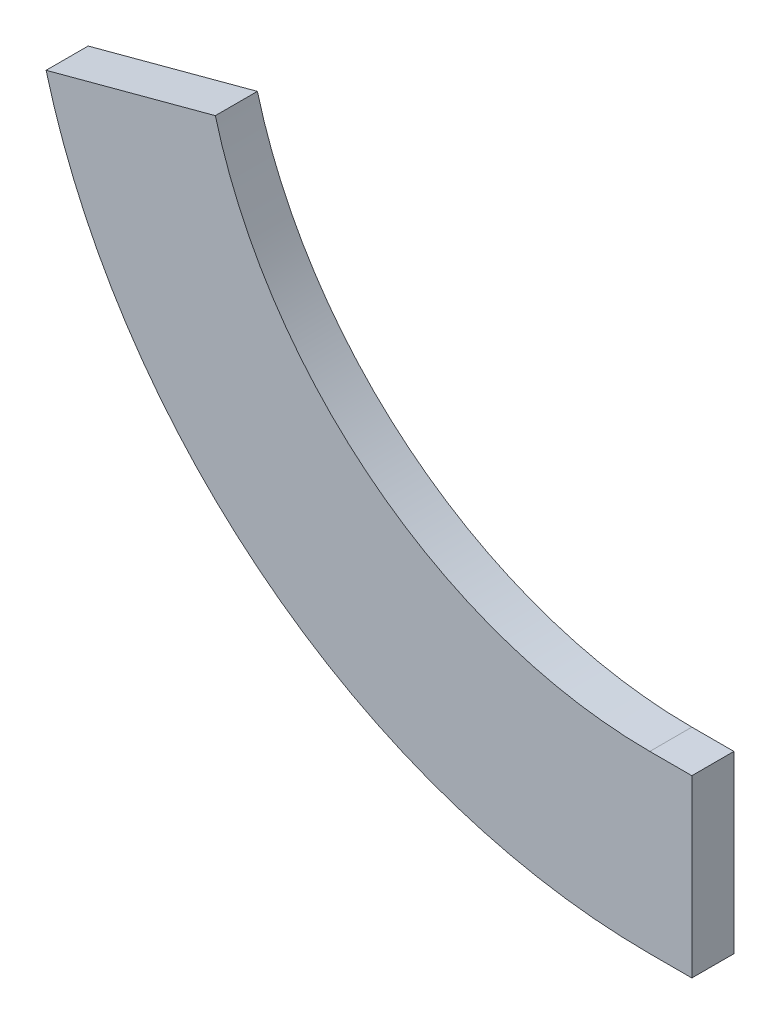
from build123d import *

# Parameters (mm, degrees)
BOSS_EXTRUDE1_DEPTH = 1.524


with BuildPart() as part:
    # Sketch1 → Boss-Extrude1 (new, symmetric)
    with BuildSketch(Plane.XY):
        with BuildLine():
            Line((-79.441088515, -31.75), (-82.489088515, -31.75))
            ThreePointArc((-82.489088515, -31.75), (-102.335160784, -25.013166247), (-113.978983967, -7.58695337))
            Line((-113.978983967, -7.58695337), (-126.246241961, -10.873955243))
            ThreePointArc((-126.246241961, -10.873955243), (-110.066430932, -35.088753668), (-82.489088515, -44.45))
            Line((-82.489088515, -44.45), (-79.441088515, -44.45))
            Line((-79.441088515, -44.45), (-79.441088515, -31.75))
        make_face()
    extrude(amount=BOSS_EXTRUDE1_DEPTH, both=True)


solid = part.part
